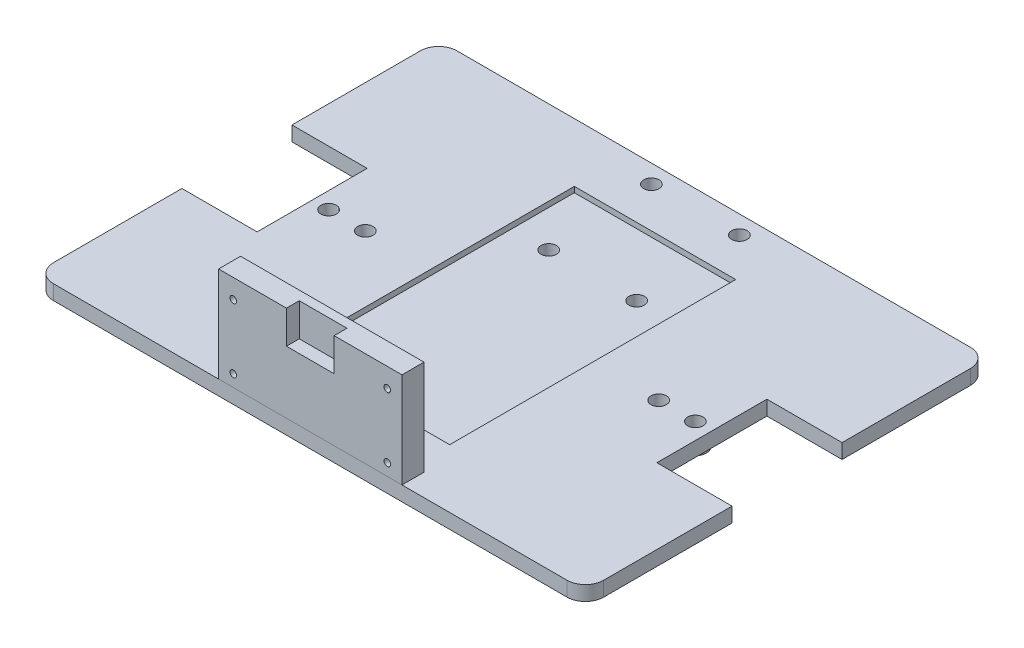
from build123d import *

# Parameters (mm, degrees)
SKETCH1_W           = 150
SKETCH1_H           = 110
BOSS_EXTRUDE1_DEPTH = 4
FILLET1_R           = 5
SKETCH2_R           = 2.1
CUT_EXTRUDE1_DEPTH  = 94.091352982
SKETCH3_R           = 3
BOSS_EXTRUDE2_DEPTH = 2
CUT_EXTRUDE2_DEPTH  = 1.5
SKETCH7_W           = 50
SKETCH7_H           = 26
BOSS_EXTRUDE4_DEPTH = 6
SKETCH10_R          = 2.1
CUT_EXTRUDE5_DEPTH  = 97.571217244
SKETCH11_W          = 20.5
SKETCH11_H          = 30
CUT_EXTRUDE6_DEPTH  = 97.571217244
SKETCH12_R          = 4
BOSS_EXTRUDE5_DEPTH = 3.5
SKETCH13_R          = 2.1
CUT_EXTRUDE7_DEPTH  = 97.571217244
SKETCH14_R          = 0.9
CUT_EXTRUDE8_DEPTH  = 4.5
SKETCH15_W          = 13
SKETCH15_H          = 9
CUT_EXTRUDE9_DEPTH  = 3.5


with BuildPart() as part:
    # Sketch1 → Boss-Extrude1 (new body)
    with BuildSketch(Plane(origin=(0, 0, 0), x_dir=(1, 0, 0), z_dir=(0, 1, 0))):
        Rectangle(SKETCH1_W, SKETCH1_H)
    extrude(amount=BOSS_EXTRUDE1_DEPTH)

    # Fillet1
    fillet1_edges = [part.edges().sort_by_distance(p)[0] for p in [
        (-75, 2, -55),
        (-75, 2, 55),
        (75, 2, -55),
        (75, 2, 55),
    ]]
    fillet(fillet1_edges, radius=FILLET1_R)

    # Sketch2 → Cut-Extrude1 (cut, through all)
    with BuildSketch(Plane(origin=(0, 4, 0), x_dir=(1, 0, 0), z_dir=(0, 1, 0))):
        with Locations((-50, 0)):
            Circle(SKETCH2_R)
        with Locations((-40, 0)):
            Circle(SKETCH2_R)
    cut_extrude1 = extrude(amount=-CUT_EXTRUDE1_DEPTH, mode=Mode.SUBTRACT)

    # Sketch3 → Boss-Extrude2 (add)
    with BuildSketch(Plane.XZ):
        with Locations((-50, 0)):
            Circle(SKETCH3_R)
        with Locations((-40, 0)):
            Circle(SKETCH3_R)
    boss_extrude2 = extrude(amount=BOSS_EXTRUDE2_DEPTH)

    # Mirror1: Cut-Extrude1, Boss-Extrude2 across plane
    add(cut_extrude1.mirror(Plane(origin=(0, 0, 0), x_dir=(0, 0, 1), z_dir=(1, 0, 0))), mode=Mode.SUBTRACT)
    add(boss_extrude2.mirror(Plane(origin=(0, 0, 0), x_dir=(0, 0, 1), z_dir=(1, 0, 0))))

    # Sketch4 → Cut-Extrude2 (cut)
    with BuildSketch(Plane(origin=(0, 4, 0), x_dir=(1, 0, 0), z_dir=(0, 1, 0))):
        Polygon((-22, -39), (-6, -39), (-6, -43), (6, -43), (6, -39), (22, -39), (22, 39), (-22, 39), align=None)
    extrude(amount=-CUT_EXTRUDE2_DEPTH, mode=Mode.SUBTRACT)

    # Sketch10 → Cut-Extrude5 (cut, through all)
    with BuildSketch(Plane(origin=(0, 4, 0), x_dir=(1, 0, 0), z_dir=(0, 1, 0))):
        with Locations((-50, 0)):
            Circle(SKETCH10_R)
        with Locations((-40, 0)):
            Circle(SKETCH10_R)
        with Locations((40, 0)):
            Circle(SKETCH10_R)
        with Locations((50, 0)):
            Circle(SKETCH10_R)
    extrude(amount=-CUT_EXTRUDE5_DEPTH, mode=Mode.SUBTRACT)

    # Sketch11 → Cut-Extrude6 (cut, through all)
    with BuildSketch(Plane(origin=(0, 4, 0), x_dir=(1, 0, 0), z_dir=(0, 1, 0))):
        with Locations((64.75, 0)):
            Rectangle(SKETCH11_W, SKETCH11_H)
        with Locations((-64.75, 0)):
            Rectangle(SKETCH11_W, SKETCH11_H)
    extrude(amount=-CUT_EXTRUDE6_DEPTH, mode=Mode.SUBTRACT)

    # Sketch12 → Boss-Extrude5 (add)
    with BuildSketch(Plane.XZ):
        with Locations((-12, -22)):
            Circle(SKETCH12_R)
        with Locations((12, -22)):
            Circle(SKETCH12_R)
        with Locations((12, -50)):
            Circle(SKETCH12_R)
        with Locations((-12, -50)):
            Circle(SKETCH12_R)
    extrude(amount=BOSS_EXTRUDE5_DEPTH)

    # Sketch13 → Cut-Extrude7 (cut, through all)
    with BuildSketch(Plane(origin=(0, 4, 0), x_dir=(1, 0, 0), z_dir=(0, 1, 0))):
        with Locations((12, 22)):
            Circle(SKETCH13_R)
        with Locations((-12, 50)):
            Circle(SKETCH13_R)
        with Locations((12, 50)):
            Circle(SKETCH13_R)
        with Locations((-12, 22)):
            Circle(SKETCH13_R)
    extrude(amount=-CUT_EXTRUDE7_DEPTH, mode=Mode.SUBTRACT)


with BuildPart() as body_2:
    # Sketch7 → Boss-Extrude4 (new body)
    with BuildSketch(Plane.XY.offset(55)):
        with Locations((0, 17)):
            Rectangle(SKETCH7_W, SKETCH7_H)
    extrude(amount=-BOSS_EXTRUDE4_DEPTH)

    # Sketch14 → Cut-Extrude8 (cut)
    with BuildSketch(Plane.XY.offset(55)):
        with Locations((-21, 24.75)):
            Circle(SKETCH14_R)
        with Locations((-21, 7.25)):
            Circle(SKETCH14_R)
        with Locations((21, 7.25)):
            Circle(SKETCH14_R)
        with Locations((21, 24.75)):
            Circle(SKETCH14_R)
    extrude(amount=-CUT_EXTRUDE8_DEPTH, mode=Mode.SUBTRACT)

    # Sketch15 → Cut-Extrude9 (cut)
    with BuildSketch(Plane.XY.offset(55)):
        with Locations((0, 25.5)):
            Rectangle(SKETCH15_W, SKETCH15_H)
    extrude(amount=-CUT_EXTRUDE9_DEPTH, mode=Mode.SUBTRACT)


solid = Compound([part.part, body_2.part])
